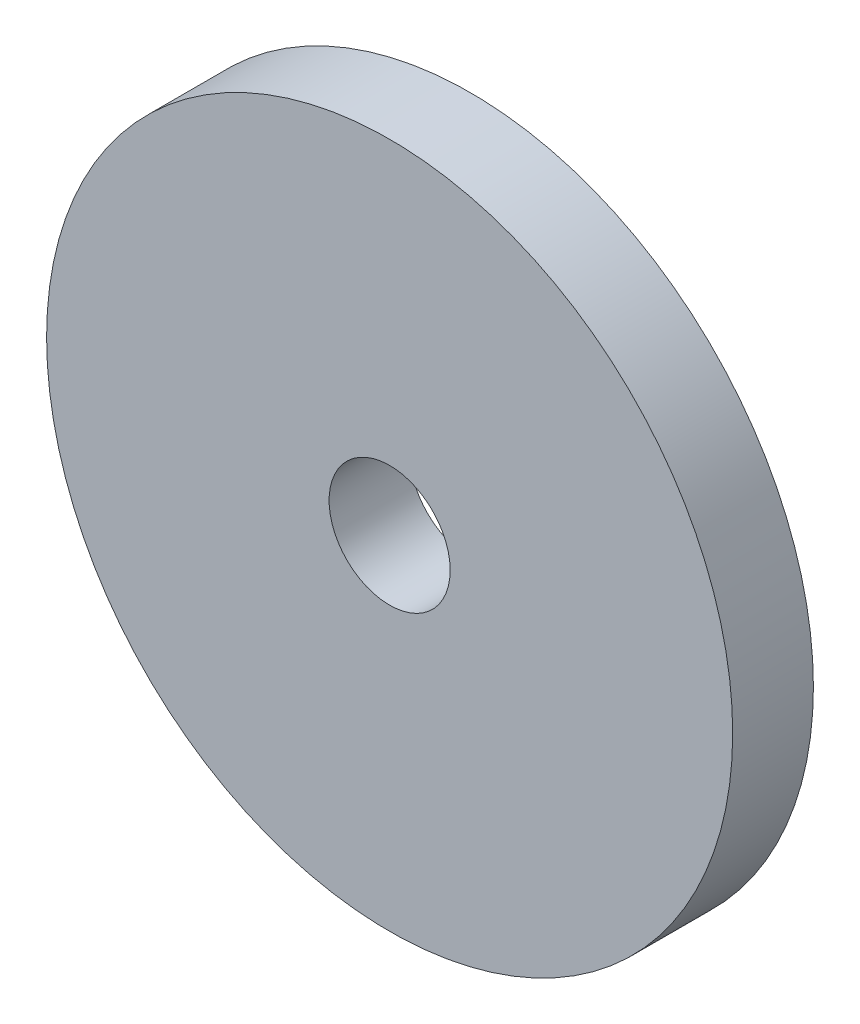
from build123d import *

# Parameters (mm, degrees)
MODEL_R             = 8.5
MODEL_R_2           = 1.5
BOSS_EXTRUDE1_DEPTH = 2


with BuildPart() as part:
    # Model → Boss-Extrude1 (new body)
    with BuildSketch(Plane.XY):
        Circle(MODEL_R)
        Circle(MODEL_R_2, mode=Mode.SUBTRACT)
    extrude(amount=BOSS_EXTRUDE1_DEPTH)


solid = part.part
